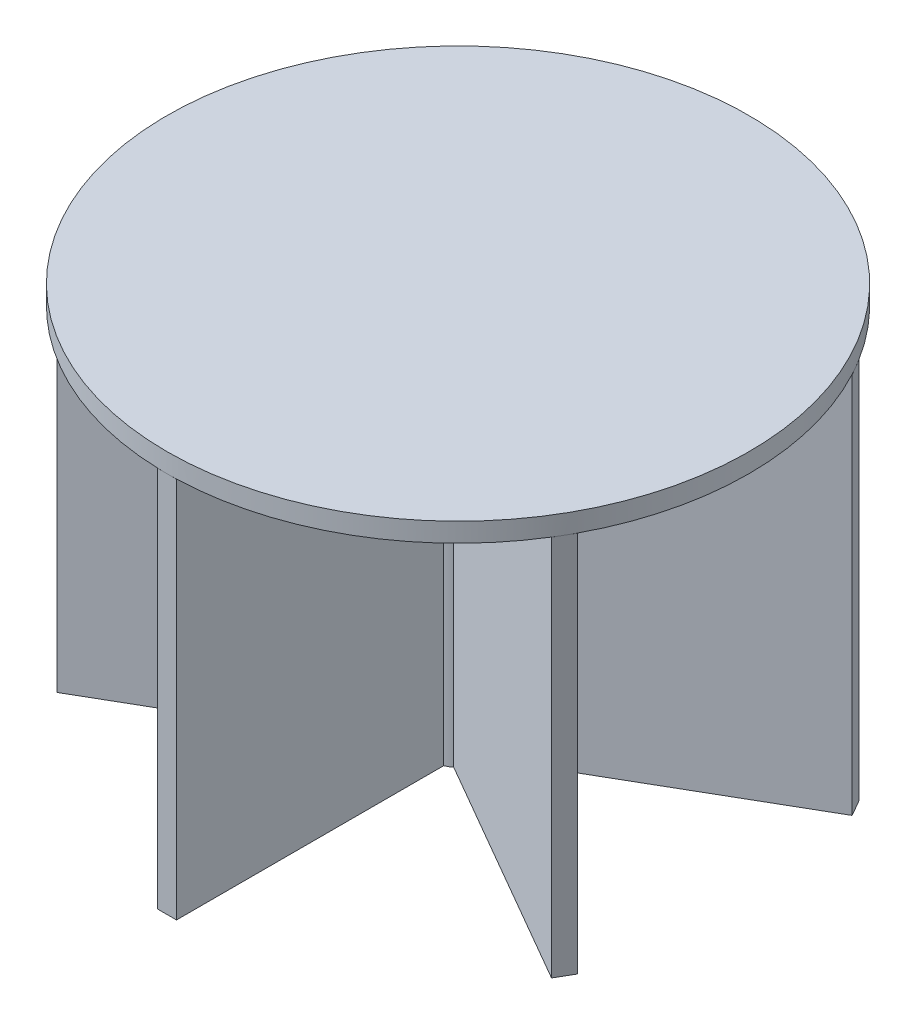
from build123d import *

# Parameters (mm, degrees)
BOSS_EXTRUDE1_DEPTH = 50.8
SKETCH2_R           = 38.735
BOSS_EXTRUDE2_DEPTH = 2.54


with BuildPart() as part:
    # Sketch1 → Boss-Extrude1 (new body)
    with BuildSketch(Plane(origin=(0, 0, 0), x_dir=(1, 0, 0), z_dir=(0, 1, 0))):
        with BuildLine():
            Line((-1.27, 3.175), (-1.27, 38.735))
            Line((-1.27, 38.735), (1.27, 38.735))
            Line((1.27, 38.735), (1.27, 3.175))
            ThreePointArc((1.27, 3.175), (1.709789826, 2.961442849), (2.114630657, 2.687352263))
            Line((2.114630657, 2.687352263), (32.910494016, 20.467352263))
            Line((32.910494016, 20.467352263), (34.180494016, 18.267647737))
            Line((34.180494016, 18.267647737), (3.384630657, 0.487647737))
            ThreePointArc((3.384630657, 0.487647737), (3.419579653, 0), (3.384630657, -0.487647737))
            Line((3.384630657, -0.487647737), (34.180494016, -18.267647737))
            Line((34.180494016, -18.267647737), (32.910494016, -20.467352263))
            Line((32.910494016, -20.467352263), (2.114630657, -2.687352263))
            ThreePointArc((2.114630657, -2.687352263), (1.709789826, -2.961442849), (1.27, -3.175))
            Line((1.27, -3.175), (1.27, -38.735))
            Line((1.27, -38.735), (-1.27, -38.735))
            Line((-1.27, -38.735), (-1.27, -3.175))
            ThreePointArc((-1.27, -3.175), (-1.709789826, -2.961442849), (-2.114630657, -2.687352263))
            Line((-2.114630657, -2.687352263), (-32.910494016, -20.467352263))
            Line((-32.910494016, -20.467352263), (-34.180494016, -18.267647737))
            Line((-34.180494016, -18.267647737), (-3.384630657, -0.487647737))
            ThreePointArc((-3.384630657, -0.487647737), (-3.419579653, 0), (-3.384630657, 0.487647737))
            Line((-3.384630657, 0.487647737), (-34.180494016, 18.267647737))
            Line((-34.180494016, 18.267647737), (-32.910494016, 20.467352263))
            Line((-32.910494016, 20.467352263), (-2.114630657, 2.687352263))
            ThreePointArc((-2.114630657, 2.687352263), (-1.709789826, 2.961442849), (-1.27, 3.175))
        make_face()
    extrude(amount=BOSS_EXTRUDE1_DEPTH)

    # Sketch2 → Boss-Extrude2 (add)
    with BuildSketch(Plane(origin=(0, 50.8, 0), x_dir=(1, 0, 0), z_dir=(0, 1, 0))):
        Circle(SKETCH2_R)
    extrude(amount=BOSS_EXTRUDE2_DEPTH)


solid = part.part
